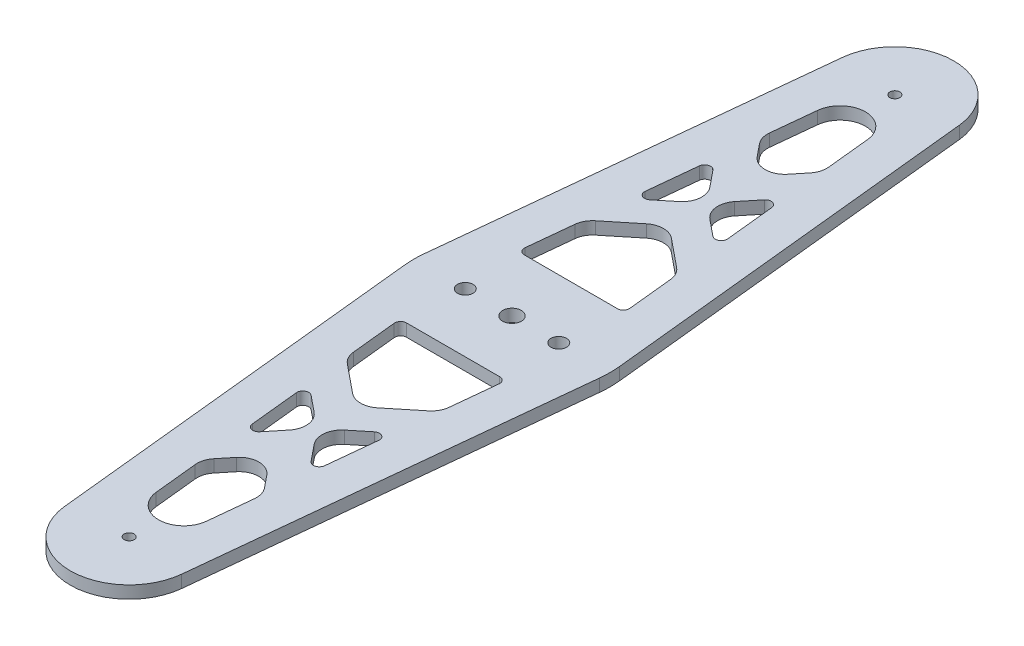
from build123d import *

# Parameters (mm, degrees)
BASE_DEPTH         = 6.35
SKETCH2_R          = 4.7752
SKETCH2_R_2        = 2.54
SKETCH2_R_3        = 3.96875
BOLTS_DEPTH        = 231.576066624
CUT_EXTRUDE1_DEPTH = 231.576066624


with BuildPart() as part:
    # Sketch1 → Base (new body)
    with BuildSketch(Plane(origin=(0, 0, 0), x_dir=(1, 0, 0), z_dir=(0, 1, 0))):
        with BuildLine():
            Line((-29.84179191, 198.076923077), (-49.736319849, 5.128205128))
            ThreePointArc((-49.736319849, 5.128205128), (-50, 0), (-49.736319849, -5.128205128))
            Line((-49.736319849, -5.128205128), (-29.84179191, -198.076923077))
            ThreePointArc((-29.84179191, -198.076923077), (0, -225), (29.84179191, -198.076923077))
            Line((29.84179191, -198.076923077), (49.736319849, -5.128205128))
            ThreePointArc((49.736319849, -5.128205128), (50, 0), (49.736319849, 5.128205128))
            Line((49.736319849, 5.128205128), (29.84179191, 198.076923077))
            ThreePointArc((29.84179191, 198.076923077), (0, 225), (-29.84179191, 198.076923077))
        make_face()
    extrude(amount=BASE_DEPTH)

    # Sketch2 → Bolts (cut, through all)
    with BuildSketch(Plane(origin=(0, 6.35, 0), x_dir=(1, 0, 0), z_dir=(0, 1, 0))):
        Circle(SKETCH2_R)
        with Locations((0, 195)):
            Circle(SKETCH2_R_2)
        with Locations((-23.8125, 0)):
            Circle(SKETCH2_R_3)
        with Locations((23.8125, 0)):
            Circle(SKETCH2_R_3)
        with Locations((0, -195)):
            Circle(SKETCH2_R_2)
    extrude(amount=-BOLTS_DEPTH, mode=Mode.SUBTRACT)

    # Sketch4 → Cut-Extrude1 (cut, through all)
    with BuildSketch(Plane(origin=(0, 6.35, 0), x_dir=(1, 0, 0), z_dir=(0, 1, 0))):
        with BuildLine():
            Line((-26.724762216, -33.307692308), (-24.340140182, -56.435145528))
            ThreePointArc((-24.340140182, -56.435145528), (-23.190453971, -60.163726372), (-20.701416296, -63.168520034))
            Line((-20.701416296, -63.168520034), (-6.308540083, -74.870782535))
            ThreePointArc((-6.308540083, -74.870782535), (0, -77.111767003), (6.308540083, -74.870782535))
            Line((6.308540083, -74.870782535), (20.701416296, -63.168520034))
            ThreePointArc((20.701416296, -63.168520034), (23.190453971, -60.163726372), (24.340140182, -56.435145528))
            Line((24.340140182, -56.435145528), (26.724762216, -33.307692308))
            ThreePointArc((26.724762216, -33.307692308), (25.968034139, -30.990407619), (23.740583026, -30))
            Line((23.740583026, -30), (-23.740583026, -30))
            ThreePointArc((-23.740583026, -30), (-25.968034139, -30.990407619), (-26.724762216, -33.307692308))
        make_face()
        with BuildLine():
            Line((16.120016428, -86.225819503), (7.759015532, -93.023809413))
            ThreePointArc((7.759015532, -93.023809413), (4.120291645, -99.757183919), (6.308540083, -107.091365027))
            Line((6.308540083, -107.091365027), (13.106529993, -115.452365924))
            ThreePointArc((13.106529993, -115.452365924), (16.291959962, -116.434574723), (18.418413843, -113.867496207))
            Line((18.418413843, -113.867496207), (20.996757644, -88.86121647))
            ThreePointArc((20.996757644, -88.86121647), (19.438845014, -85.914250835), (16.120016428, -86.225819503))
        make_face()
        with BuildLine():
            Line((-6.308540083, -107.091365027), (-13.106529993, -115.452365924))
            ThreePointArc((-13.106529993, -115.452365924), (-16.291959962, -116.434574723), (-18.418413843, -113.867496207))
            Line((-18.418413843, -113.867496207), (-20.996757644, -88.86121647))
            ThreePointArc((-20.996757644, -88.86121647), (-19.438845014, -85.914250835), (-16.120016428, -86.225819503))
            Line((-16.120016428, -86.225819503), (-7.759015532, -93.023809413))
            ThreePointArc((-7.759015532, -93.023809413), (-4.120291645, -99.757183919), (-6.308540083, -107.091365027))
        make_face()
        with BuildLine():
            Line((-7.759015532, -132.652629505), (-12.886782867, -138.95938604))
            ThreePointArc((-12.886782867, -138.95938604), (-14.710336749, -142.408841756), (-15.075031305, -146.293567149))
            Line((-15.075031305, -146.293567149), (-12.78933939, -168.461538462))
            ThreePointArc((-12.78933939, -168.461538462), (0, -180), (12.78933939, -168.461538462))
            Line((12.78933939, -168.461538462), (15.075031305, -146.293567149))
            ThreePointArc((15.075031305, -146.293567149), (14.710336749, -142.408841756), (12.886782867, -138.95938604))
            Line((12.886782867, -138.95938604), (7.759015532, -132.652629505))
            ThreePointArc((7.759015532, -132.652629505), (0, -128.961169588), (-7.759015532, -132.652629505))
        make_face()
        with BuildLine():
            Line((24.340140182, 56.435145528), (26.724762216, 33.307692308))
            ThreePointArc((26.724762216, 33.307692308), (25.968034139, 30.990407619), (23.740583026, 30))
            Line((23.740583026, 30), (-23.740583026, 30))
            ThreePointArc((-23.740583026, 30), (-25.968034139, 30.990407619), (-26.724762216, 33.307692308))
            Line((-26.724762216, 33.307692308), (-24.340140182, 56.435145528))
            ThreePointArc((-24.340140182, 56.435145528), (-23.190453971, 60.163726372), (-20.701416296, 63.168520034))
            Line((-20.701416296, 63.168520034), (-6.308540083, 74.870782535))
            ThreePointArc((-6.308540083, 74.870782535), (0, 77.111767003), (6.308540083, 74.870782535))
            Line((6.308540083, 74.870782535), (20.701416296, 63.168520034))
            ThreePointArc((20.701416296, 63.168520034), (23.190453971, 60.163726372), (24.340140182, 56.435145528))
        make_face()
        with BuildLine():
            Line((-16.120016428, 86.225819503), (-7.759015532, 93.023809413))
            ThreePointArc((-7.759015532, 93.023809413), (-4.120291645, 99.757183919), (-6.308540083, 107.091365027))
            Line((-6.308540083, 107.091365027), (-13.106529993, 115.452365924))
            ThreePointArc((-13.106529993, 115.452365924), (-16.291959962, 116.434574723), (-18.418413843, 113.867496207))
            Line((-18.418413843, 113.867496207), (-20.996757644, 88.86121647))
            ThreePointArc((-20.996757644, 88.86121647), (-19.438845014, 85.914250835), (-16.120016428, 86.225819503))
        make_face()
        with BuildLine():
            Line((6.308540083, 107.091365027), (13.106529993, 115.452365924))
            ThreePointArc((13.106529993, 115.452365924), (16.291959962, 116.434574723), (18.418413843, 113.867496207))
            Line((18.418413843, 113.867496207), (20.996757644, 88.86121647))
            ThreePointArc((20.996757644, 88.86121647), (19.438845014, 85.914250835), (16.120016428, 86.225819503))
            Line((16.120016428, 86.225819503), (7.759015532, 93.023809413))
            ThreePointArc((7.759015532, 93.023809413), (4.120291645, 99.757183919), (6.308540083, 107.091365027))
        make_face()
        with BuildLine():
            Line((12.78933939, 168.461538462), (15.075031305, 146.293567149))
            ThreePointArc((15.075031305, 146.293567149), (14.710336749, 142.408841756), (12.886782867, 138.95938604))
            Line((12.886782867, 138.95938604), (7.759015532, 132.652629505))
            ThreePointArc((7.759015532, 132.652629505), (0, 128.961169588), (-7.759015532, 132.652629505))
            Line((-7.759015532, 132.652629505), (-12.886782867, 138.95938604))
            ThreePointArc((-12.886782867, 138.95938604), (-14.710336749, 142.408841756), (-15.075031305, 146.293567149))
            Line((-15.075031305, 146.293567149), (-12.78933939, 168.461538462))
            ThreePointArc((-12.78933939, 168.461538462), (0, 180), (12.78933939, 168.461538462))
        make_face()
    extrude(amount=-CUT_EXTRUDE1_DEPTH, mode=Mode.SUBTRACT)


solid = part.part
